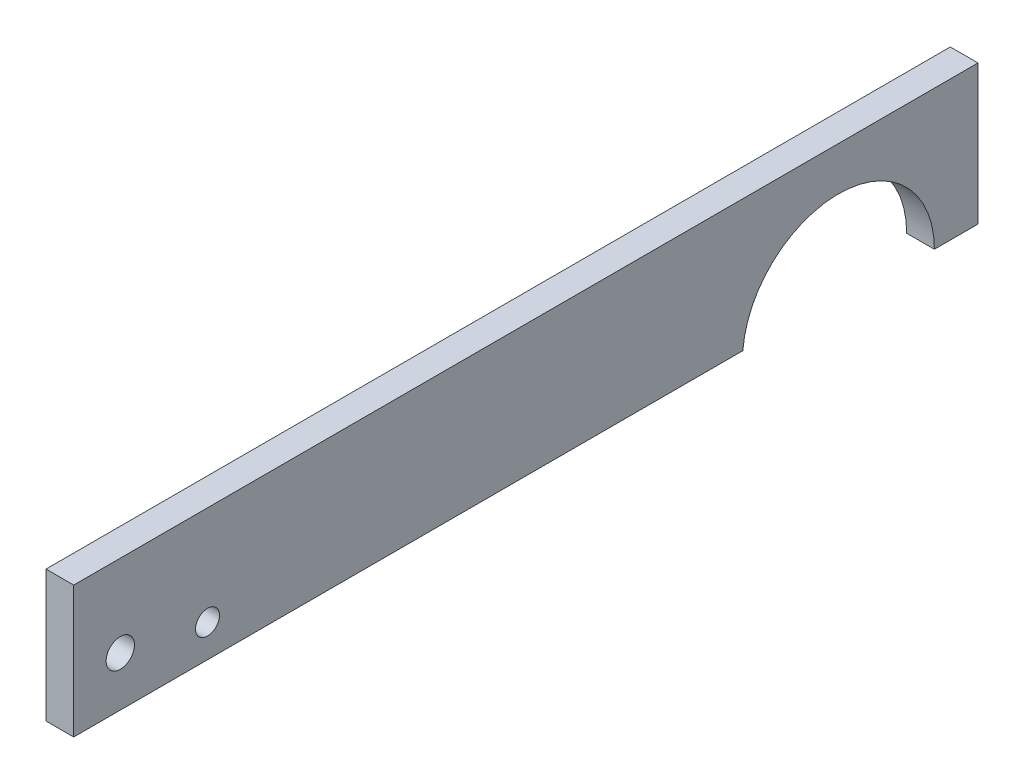
from build123d import *

# Parameters (mm, degrees)
SKETCH1_R           = 3.25
SKETCH1_R_2         = 2.75
BOSS_EXTRUDE1_DEPTH = 6.35


with BuildPart() as part:
    # Sketch1 → Boss-Extrude1 (new body)
    with BuildSketch(Plane(origin=(0, 0, 0), x_dir=(0, 0, -1), z_dir=(1, 0, 0))):
        with BuildLine():
            Line((-175.353584658, 32), (32, 32))
            Line((32, 32), (32, 0))
            Line((32, 0), (22, 0))
            ThreePointArc((22, 0), (0.91041892, 21.981154141), (-21.924648854, 1.819278055))
            Line((-21.924648854, 1.819278055), (-175.353584658, 1.819278055))
            Line((-175.353584658, 1.819278055), (-175.353584658, 32))
        make_face()
        with Locations((-164.67, 13.1796749)):
            Circle(SKETCH1_R, mode=Mode.SUBTRACT)
        with Locations((-144.67, 9.287146811)):
            Circle(SKETCH1_R_2, mode=Mode.SUBTRACT)
    extrude(amount=BOSS_EXTRUDE1_DEPTH)


solid = part.part
